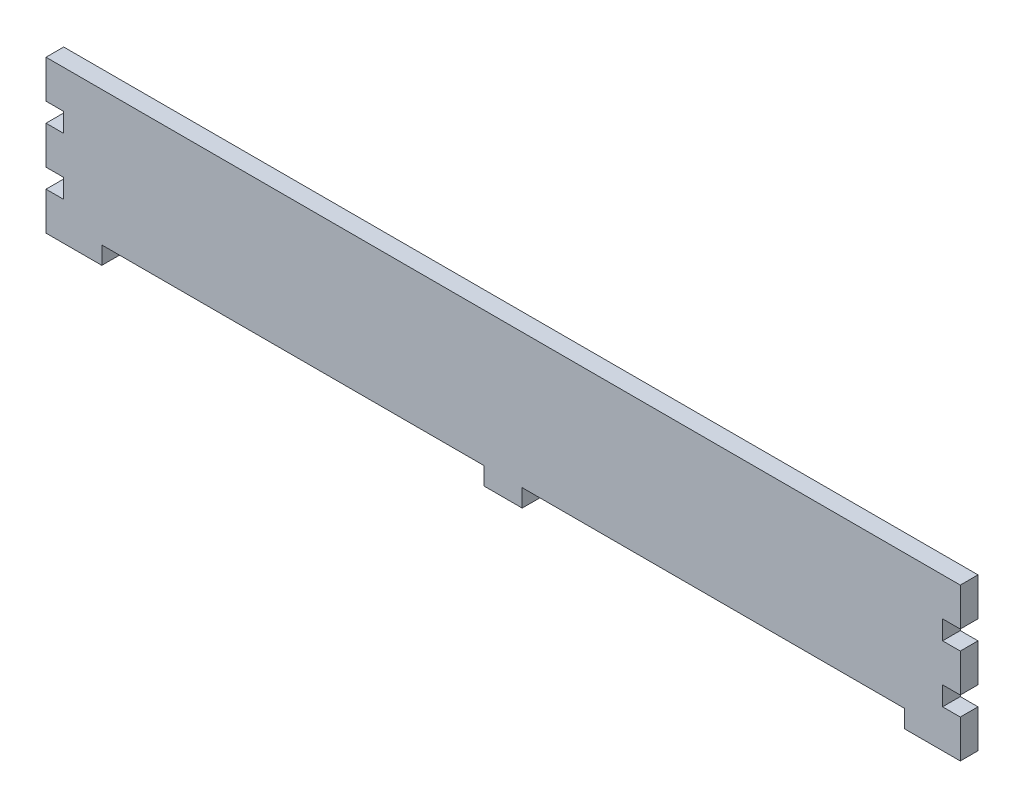
from build123d import *

# Parameters (mm, degrees)
BOSS_EXTRUDE1_START     = -445.39
BOSS_EXTRUDE1_OUTLINE_W = 89.79
BOSS_EXTRUDE1_OUTLINE_H = 11.81
BOSS_EXTRUDE1_DEPTH     = 585.980036335
JOINT_X_W               = 25.4
JOINT_X_H               = 11.81
BOSS_EXTRUDE2_DEPTH     = 11.81
LPATTERN1_COUNT         = 3
LPATTERN1_PITCH         = 280.290018167
JOINT_Y_W               = 11.81
JOINT_Y_H               = 25.4
BOSS_EXTRUDE3_DEPTH     = 11.81
LPATTERN2_COUNT         = 3
LPATTERN2_PITCH         = 38.1
MIRROR3_COPY_1_SKETCH_W = 11.81
MIRROR3_COPY_1_SKETCH_H = 25.4
MIRROR3_COPY_1_DEPTH    = 11.81
MIRROR3_COPY_2_SKETCH_W = 11.81
MIRROR3_COPY_2_SKETCH_H = 25.4
MIRROR3_COPY_2_DEPTH    = 11.81


# Read off the part's stored shape, not the designer's step: Boss-Extrude1
with BuildPart() as part:
    # Boss-Extrude1 outline → Boss-Extrude1 (new body)
    with BuildSketch(Plane.YZ.offset(BOSS_EXTRUDE1_START)):
        with Locations((52.039215162, 5.905)):
            Rectangle(BOSS_EXTRUDE1_OUTLINE_W, BOSS_EXTRUDE1_OUTLINE_H)
    extrude(amount=BOSS_EXTRUDE1_DEPTH)

    # Joint_X → Boss-Extrude2 (add)
    with BuildSketch(Plane.XY.offset(11.81)):
        with Locations((-432.69, 1.239215162)):
            Rectangle(JOINT_X_W, JOINT_X_H)
    boss_extrude2 = extrude(amount=-BOSS_EXTRUDE2_DEPTH)

    # LPattern1: Boss-Extrude2 ×3
    with Locations(*[(i * LPATTERN1_PITCH, 0, 0) for i in range(1, LPATTERN1_COUNT)]):
        add(boss_extrude2)

    # Joint_Y → Boss-Extrude3 (add)
    with BuildSketch(Plane.XY.offset(11.81)):
        with Locations((-451.295, 8.034215162)):
            Rectangle(JOINT_Y_W, JOINT_Y_H)
    boss_extrude3 = extrude(amount=-BOSS_EXTRUDE3_DEPTH)

    # LPattern2: Boss-Extrude3 ×3
    with Locations(*[(0, i * LPATTERN2_PITCH, 0) for i in range(1, LPATTERN2_COUNT)]):
        add(boss_extrude3)

    # Mirror3: Boss-Extrude3 across plane
    add(boss_extrude3.mirror(Plane.ZY.offset(152.399981833)))

    # Mirror3 copy 1 sketch → Mirror3 copy 1 (add)
    with BuildSketch(Plane(origin=(-304.799963665, 38.1, 11.81), x_dir=(-1, 0, 0), z_dir=(0, 0, 1))):
        with Locations((-451.295, -8.034215162)):
            Rectangle(MIRROR3_COPY_1_SKETCH_W, MIRROR3_COPY_1_SKETCH_H)
    extrude(amount=-MIRROR3_COPY_1_DEPTH)

    # Mirror3 copy 2 sketch → Mirror3 copy 2 (add)
    with BuildSketch(Plane(origin=(-304.799963665, 76.2, 11.81), x_dir=(-1, 0, 0), z_dir=(0, 0, 1))):
        with Locations((-451.295, -8.034215162)):
            Rectangle(MIRROR3_COPY_2_SKETCH_W, MIRROR3_COPY_2_SKETCH_H)
    extrude(amount=-MIRROR3_COPY_2_DEPTH)


solid = part.part
